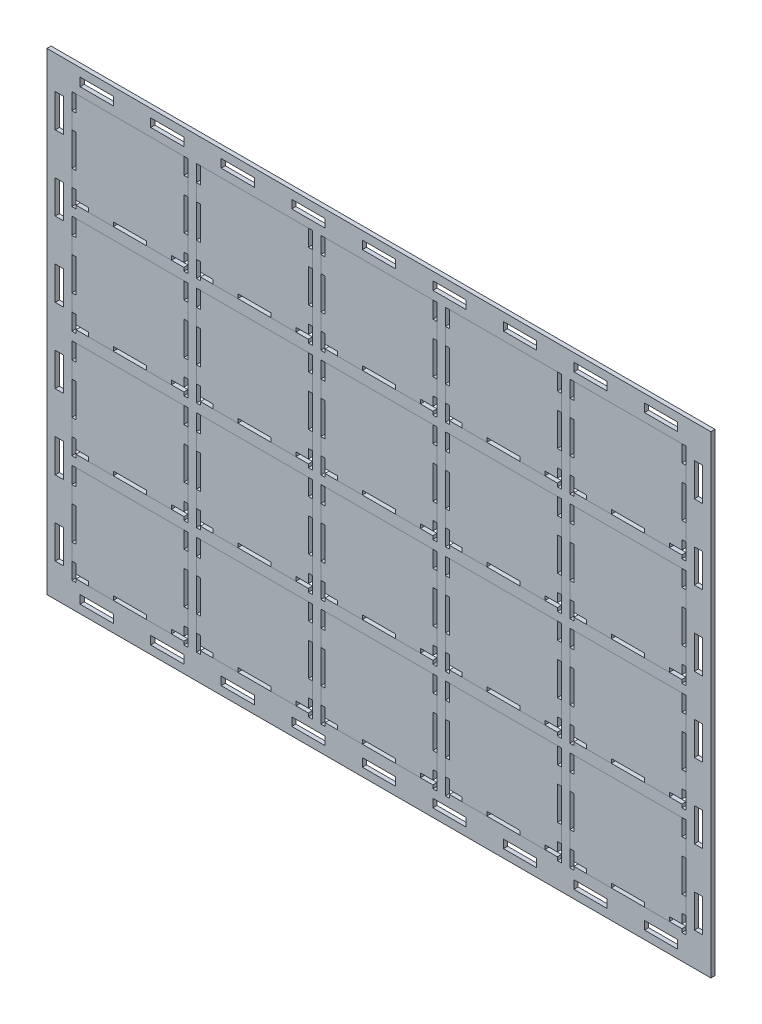
from build123d import *

# Parameters (mm, degrees)
SKETCH1_W              = 400
SKETCH1_H              = 285
SKETCH1_W_2            = 20
SKETCH1_H_2            = 5
SKETCH1_W_3            = 5
SKETCH1_H_3            = 20
BOSS_EXTRUDE1_DEPTH    = 2.5
BOSS_EXTRUDE2_DEPTH    = 2.5
BOSS_EXTRUDE2_2_DEPTH  = 2.5
BOSS_EXTRUDE2_3_DEPTH  = 2.5
BOSS_EXTRUDE2_4_DEPTH  = 2.5
BOSS_EXTRUDE2_5_DEPTH  = 2.5
BOSS_EXTRUDE2_6_DEPTH  = 2.5
BOSS_EXTRUDE2_7_DEPTH  = 2.5
BOSS_EXTRUDE2_8_DEPTH  = 2.5
BOSS_EXTRUDE2_9_DEPTH  = 2.5
BOSS_EXTRUDE2_10_DEPTH = 2.5
BOSS_EXTRUDE2_11_DEPTH = 2.5
BOSS_EXTRUDE2_12_DEPTH = 2.5
BOSS_EXTRUDE2_13_DEPTH = 2.5
BOSS_EXTRUDE2_14_DEPTH = 2.5
BOSS_EXTRUDE2_15_DEPTH = 2.5
BOSS_EXTRUDE2_16_DEPTH = 2.5
BOSS_EXTRUDE2_17_DEPTH = 2.5
BOSS_EXTRUDE2_18_DEPTH = 2.5
BOSS_EXTRUDE2_19_DEPTH = 2.5
BOSS_EXTRUDE2_20_DEPTH = 2.5


with BuildPart() as part:
    # Sketch1 → Boss-Extrude1 (new body)
    with BuildSketch(Plane.XY):
        with Locations((-141.295954422, 26.855853659)):
            Rectangle(SKETCH1_W, SKETCH1_H)
        with Locations((-311.295954422, -108.144146341)):
            Rectangle(SKETCH1_W_2, SKETCH1_H_2, mode=Mode.SUBTRACT)
        with Locations((-333.795954422, -85.644146341)):
            Rectangle(SKETCH1_W_3, SKETCH1_H_3, mode=Mode.SUBTRACT)
        with Locations((-268.795954422, -108.144146341)):
            Rectangle(SKETCH1_W_2, SKETCH1_H_2, mode=Mode.SUBTRACT)
        Polygon((-323.795954422, -98.644146341), (-323.795954422, -100.644146341), (-326.295954422, -100.644146341), (-326.295954422, -90.644146341), (-326.295954422, -80.644146341), (-326.295954422, -60.644146341), (-326.295954422, -50.644146341), (-326.295954422, -40.644146341), (-323.795954422, -40.644146341), (-258.795954422, -40.644146341), (-256.295954422, -40.644146341), (-256.295954422, -50.644146341), (-256.295954422, -60.644146341), (-256.295954422, -80.644146341), (-256.295954422, -90.644146341), (-256.295954422, -100.644146341), (-258.795954422, -100.644146341), (-258.795954422, -98.644146341), (-266.295954422, -98.644146341), (-281.295954422, -98.644146341), (-301.295954422, -98.644146341), (-316.295954422, -98.644146341), align=None, mode=Mode.SUBTRACT)
        with Locations((-226.295954422, -108.144146341)):
            Rectangle(SKETCH1_W_2, SKETCH1_H_2, mode=Mode.SUBTRACT)
        with Locations((-183.795954422, -108.144146341)):
            Rectangle(SKETCH1_W_2, SKETCH1_H_2, mode=Mode.SUBTRACT)
        Polygon((-248.795954422, -98.644146341), (-248.795954422, -100.644146341), (-251.295954422, -100.644146341), (-251.295954422, -90.644146341), (-251.295954422, -80.644146341), (-251.295954422, -60.644146341), (-251.295954422, -50.644146341), (-251.295954422, -40.644146341), (-248.795954422, -40.644146341), (-183.795954422, -40.644146341), (-181.295954422, -40.644146341), (-181.295954422, -50.644146341), (-181.295954422, -60.644146341), (-181.295954422, -80.644146341), (-181.295954422, -90.644146341), (-181.295954422, -100.644146341), (-183.795954422, -100.644146341), (-183.795954422, -98.644146341), (-191.295954422, -98.644146341), (-206.295954422, -98.644146341), (-226.295954422, -98.644146341), (-241.295954422, -98.644146341), align=None, mode=Mode.SUBTRACT)
        with Locations((-333.795954422, -40.644146341)):
            Rectangle(SKETCH1_W_3, SKETCH1_H_3, mode=Mode.SUBTRACT)
        with Locations((-333.795954422, 4.355853659)):
            Rectangle(SKETCH1_W_3, SKETCH1_H_3, mode=Mode.SUBTRACT)
        Polygon((-323.795954422, -33.644146341), (-323.795954422, -35.644146341), (-326.295954422, -35.644146341), (-326.295954422, -25.644146341), (-326.295954422, -15.644146341), (-326.295954422, 4.355853659), (-326.295954422, 14.355853659), (-326.295954422, 24.355853659), (-323.795954422, 24.355853659), (-258.795954422, 24.355853659), (-256.295954422, 24.355853659), (-256.295954422, 14.355853659), (-256.295954422, 4.355853659), (-256.295954422, -15.644146341), (-256.295954422, -25.644146341), (-256.295954422, -35.644146341), (-258.795954422, -35.644146341), (-258.795954422, -33.644146341), (-266.295954422, -33.644146341), (-281.295954422, -33.644146341), (-301.295954422, -33.644146341), (-316.295954422, -33.644146341), align=None, mode=Mode.SUBTRACT)
        Polygon((-248.795954422, -33.644146341), (-248.795954422, -35.644146341), (-251.295954422, -35.644146341), (-251.295954422, -25.644146341), (-251.295954422, -15.644146341), (-251.295954422, 4.355853659), (-251.295954422, 14.355853659), (-251.295954422, 24.355853659), (-248.795954422, 24.355853659), (-183.795954422, 24.355853659), (-181.295954422, 24.355853659), (-181.295954422, 14.355853659), (-181.295954422, 4.355853659), (-181.295954422, -15.644146341), (-181.295954422, -25.644146341), (-181.295954422, -35.644146341), (-183.795954422, -35.644146341), (-183.795954422, -33.644146341), (-191.295954422, -33.644146341), (-206.295954422, -33.644146341), (-226.295954422, -33.644146341), (-241.295954422, -33.644146341), align=None, mode=Mode.SUBTRACT)
        with Locations((-141.295954422, -108.144146341)):
            Rectangle(SKETCH1_W_2, SKETCH1_H_2, mode=Mode.SUBTRACT)
        with Locations((-98.795954422, -108.144146341)):
            Rectangle(SKETCH1_W_2, SKETCH1_H_2, mode=Mode.SUBTRACT)
        with Locations((-56.295954422, -108.144146341)):
            Rectangle(SKETCH1_W_2, SKETCH1_H_2, mode=Mode.SUBTRACT)
        Polygon((-173.795954422, -98.644146341), (-173.795954422, -100.644146341), (-176.295954422, -100.644146341), (-176.295954422, -90.644146341), (-176.295954422, -80.644146341), (-176.295954422, -60.644146341), (-176.295954422, -50.644146341), (-176.295954422, -40.644146341), (-173.795954422, -40.644146341), (-108.795954422, -40.644146341), (-106.295954422, -40.644146341), (-106.295954422, -50.644146341), (-106.295954422, -60.644146341), (-106.295954422, -80.644146341), (-106.295954422, -90.644146341), (-106.295954422, -100.644146341), (-108.795954422, -100.644146341), (-108.795954422, -98.644146341), (-116.295954422, -98.644146341), (-131.295954422, -98.644146341), (-151.295954422, -98.644146341), (-166.295954422, -98.644146341), align=None, mode=Mode.SUBTRACT)
        Polygon((-98.795954422, -98.644146341), (-98.795954422, -100.644146341), (-101.295954422, -100.644146341), (-101.295954422, -90.644146341), (-101.295954422, -80.644146341), (-101.295954422, -60.644146341), (-101.295954422, -50.644146341), (-101.295954422, -40.644146341), (-98.795954422, -40.644146341), (-33.795954422, -40.644146341), (-31.295954422, -40.644146341), (-31.295954422, -50.644146341), (-31.295954422, -60.644146341), (-31.295954422, -80.644146341), (-31.295954422, -90.644146341), (-31.295954422, -100.644146341), (-33.795954422, -100.644146341), (-33.795954422, -98.644146341), (-41.295954422, -98.644146341), (-56.295954422, -98.644146341), (-76.295954422, -98.644146341), (-91.295954422, -98.644146341), align=None, mode=Mode.SUBTRACT)
        with Locations((-13.795954422, -108.144146341)):
            Rectangle(SKETCH1_W_2, SKETCH1_H_2, mode=Mode.SUBTRACT)
        with Locations((28.704045578, -108.144146341)):
            Rectangle(SKETCH1_W_2, SKETCH1_H_2, mode=Mode.SUBTRACT)
        with Locations((51.204045578, -85.644146341)):
            Rectangle(SKETCH1_W_3, SKETCH1_H_3, mode=Mode.SUBTRACT)
        Polygon((-23.795954422, -98.644146341), (-23.795954422, -100.644146341), (-26.295954422, -100.644146341), (-26.295954422, -90.644146341), (-26.295954422, -80.644146341), (-26.295954422, -60.644146341), (-26.295954422, -50.644146341), (-26.295954422, -40.644146341), (-23.795954422, -40.644146341), (41.204045578, -40.644146341), (43.704045578, -40.644146341), (43.704045578, -50.644146341), (43.704045578, -60.644146341), (43.704045578, -80.644146341), (43.704045578, -90.644146341), (43.704045578, -100.644146341), (41.204045578, -100.644146341), (41.204045578, -98.644146341), (33.704045578, -98.644146341), (18.704045578, -98.644146341), (-1.295954422, -98.644146341), (-16.295954422, -98.644146341), align=None, mode=Mode.SUBTRACT)
        Polygon((-173.795954422, -33.644146341), (-173.795954422, -35.644146341), (-176.295954422, -35.644146341), (-176.295954422, -25.644146341), (-176.295954422, -15.644146341), (-176.295954422, 4.355853659), (-176.295954422, 14.355853659), (-176.295954422, 24.355853659), (-173.795954422, 24.355853659), (-108.795954422, 24.355853659), (-106.295954422, 24.355853659), (-106.295954422, 14.355853659), (-106.295954422, 4.355853659), (-106.295954422, -15.644146341), (-106.295954422, -25.644146341), (-106.295954422, -35.644146341), (-108.795954422, -35.644146341), (-108.795954422, -33.644146341), (-116.295954422, -33.644146341), (-131.295954422, -33.644146341), (-151.295954422, -33.644146341), (-166.295954422, -33.644146341), align=None, mode=Mode.SUBTRACT)
        Polygon((-98.795954422, -33.644146341), (-98.795954422, -35.644146341), (-101.295954422, -35.644146341), (-101.295954422, -25.644146341), (-101.295954422, -15.644146341), (-101.295954422, 4.355853659), (-101.295954422, 14.355853659), (-101.295954422, 24.355853659), (-98.795954422, 24.355853659), (-33.795954422, 24.355853659), (-31.295954422, 24.355853659), (-31.295954422, 14.355853659), (-31.295954422, 4.355853659), (-31.295954422, -15.644146341), (-31.295954422, -25.644146341), (-31.295954422, -35.644146341), (-33.795954422, -35.644146341), (-33.795954422, -33.644146341), (-41.295954422, -33.644146341), (-56.295954422, -33.644146341), (-76.295954422, -33.644146341), (-91.295954422, -33.644146341), align=None, mode=Mode.SUBTRACT)
        with Locations((51.204045578, -40.644146341)):
            Rectangle(SKETCH1_W_3, SKETCH1_H_3, mode=Mode.SUBTRACT)
        Polygon((-23.795954422, -33.644146341), (-23.795954422, -35.644146341), (-26.295954422, -35.644146341), (-26.295954422, -25.644146341), (-26.295954422, -15.644146341), (-26.295954422, 4.355853659), (-26.295954422, 14.355853659), (-26.295954422, 24.355853659), (-23.795954422, 24.355853659), (41.204045578, 24.355853659), (43.704045578, 24.355853659), (43.704045578, 14.355853659), (43.704045578, 4.355853659), (43.704045578, -15.644146341), (43.704045578, -25.644146341), (43.704045578, -35.644146341), (41.204045578, -35.644146341), (41.204045578, -33.644146341), (33.704045578, -33.644146341), (18.704045578, -33.644146341), (-1.295954422, -33.644146341), (-16.295954422, -33.644146341), align=None, mode=Mode.SUBTRACT)
        with Locations((51.204045578, 4.355853659)):
            Rectangle(SKETCH1_W_3, SKETCH1_H_3, mode=Mode.SUBTRACT)
        with Locations((-333.795954422, 49.355853659)):
            Rectangle(SKETCH1_W_3, SKETCH1_H_3, mode=Mode.SUBTRACT)
        Polygon((-323.795954422, 31.355853659), (-323.795954422, 29.355853659), (-326.295954422, 29.355853659), (-326.295954422, 39.355853659), (-326.295954422, 49.355853659), (-326.295954422, 69.355853659), (-326.295954422, 79.355853659), (-326.295954422, 89.355853659), (-323.795954422, 89.355853659), (-258.795954422, 89.355853659), (-256.295954422, 89.355853659), (-256.295954422, 79.355853659), (-256.295954422, 69.355853659), (-256.295954422, 49.355853659), (-256.295954422, 39.355853659), (-256.295954422, 29.355853659), (-258.795954422, 29.355853659), (-258.795954422, 31.355853659), (-266.295954422, 31.355853659), (-281.295954422, 31.355853659), (-301.295954422, 31.355853659), (-316.295954422, 31.355853659), align=None, mode=Mode.SUBTRACT)
        with Locations((-333.795954422, 94.355853659)):
            Rectangle(SKETCH1_W_3, SKETCH1_H_3, mode=Mode.SUBTRACT)
        Polygon((-248.795954422, 31.355853659), (-248.795954422, 29.355853659), (-251.295954422, 29.355853659), (-251.295954422, 39.355853659), (-251.295954422, 49.355853659), (-251.295954422, 69.355853659), (-251.295954422, 79.355853659), (-251.295954422, 89.355853659), (-248.795954422, 89.355853659), (-183.795954422, 89.355853659), (-181.295954422, 89.355853659), (-181.295954422, 79.355853659), (-181.295954422, 69.355853659), (-181.295954422, 49.355853659), (-181.295954422, 39.355853659), (-181.295954422, 29.355853659), (-183.795954422, 29.355853659), (-183.795954422, 31.355853659), (-191.295954422, 31.355853659), (-206.295954422, 31.355853659), (-226.295954422, 31.355853659), (-241.295954422, 31.355853659), align=None, mode=Mode.SUBTRACT)
        Polygon((-323.795954422, 96.355853659), (-323.795954422, 94.355853659), (-326.295954422, 94.355853659), (-326.295954422, 104.355853659), (-326.295954422, 114.355853659), (-326.295954422, 134.355853659), (-326.295954422, 144.355853659), (-326.295954422, 154.355853659), (-323.795954422, 154.355853659), (-258.795954422, 154.355853659), (-256.295954422, 154.355853659), (-256.295954422, 144.355853659), (-256.295954422, 134.355853659), (-256.295954422, 114.355853659), (-256.295954422, 104.355853659), (-256.295954422, 94.355853659), (-258.795954422, 94.355853659), (-258.795954422, 96.355853659), (-266.295954422, 96.355853659), (-281.295954422, 96.355853659), (-301.295954422, 96.355853659), (-316.295954422, 96.355853659), align=None, mode=Mode.SUBTRACT)
        with Locations((-333.795954422, 139.355853659)):
            Rectangle(SKETCH1_W_3, SKETCH1_H_3, mode=Mode.SUBTRACT)
        with Locations((-311.295954422, 161.855853659)):
            Rectangle(SKETCH1_W_2, SKETCH1_H_2, mode=Mode.SUBTRACT)
        with Locations((-268.795954422, 161.855853659)):
            Rectangle(SKETCH1_W_2, SKETCH1_H_2, mode=Mode.SUBTRACT)
        Polygon((-248.795954422, 96.355853659), (-248.795954422, 94.355853659), (-251.295954422, 94.355853659), (-251.295954422, 104.355853659), (-251.295954422, 114.355853659), (-251.295954422, 134.355853659), (-251.295954422, 144.355853659), (-251.295954422, 154.355853659), (-248.795954422, 154.355853659), (-183.795954422, 154.355853659), (-181.295954422, 154.355853659), (-181.295954422, 144.355853659), (-181.295954422, 134.355853659), (-181.295954422, 114.355853659), (-181.295954422, 104.355853659), (-181.295954422, 94.355853659), (-183.795954422, 94.355853659), (-183.795954422, 96.355853659), (-191.295954422, 96.355853659), (-206.295954422, 96.355853659), (-226.295954422, 96.355853659), (-241.295954422, 96.355853659), align=None, mode=Mode.SUBTRACT)
        with Locations((-226.295954422, 161.855853659)):
            Rectangle(SKETCH1_W_2, SKETCH1_H_2, mode=Mode.SUBTRACT)
        with Locations((-183.795954422, 161.855853659)):
            Rectangle(SKETCH1_W_2, SKETCH1_H_2, mode=Mode.SUBTRACT)
        Polygon((-173.795954422, 31.355853659), (-173.795954422, 29.355853659), (-176.295954422, 29.355853659), (-176.295954422, 39.355853659), (-176.295954422, 49.355853659), (-176.295954422, 69.355853659), (-176.295954422, 79.355853659), (-176.295954422, 89.355853659), (-173.795954422, 89.355853659), (-108.795954422, 89.355853659), (-106.295954422, 89.355853659), (-106.295954422, 79.355853659), (-106.295954422, 69.355853659), (-106.295954422, 49.355853659), (-106.295954422, 39.355853659), (-106.295954422, 29.355853659), (-108.795954422, 29.355853659), (-108.795954422, 31.355853659), (-116.295954422, 31.355853659), (-131.295954422, 31.355853659), (-151.295954422, 31.355853659), (-166.295954422, 31.355853659), align=None, mode=Mode.SUBTRACT)
        Polygon((-98.795954422, 31.355853659), (-98.795954422, 29.355853659), (-101.295954422, 29.355853659), (-101.295954422, 39.355853659), (-101.295954422, 49.355853659), (-101.295954422, 69.355853659), (-101.295954422, 79.355853659), (-101.295954422, 89.355853659), (-98.795954422, 89.355853659), (-33.795954422, 89.355853659), (-31.295954422, 89.355853659), (-31.295954422, 79.355853659), (-31.295954422, 69.355853659), (-31.295954422, 49.355853659), (-31.295954422, 39.355853659), (-31.295954422, 29.355853659), (-33.795954422, 29.355853659), (-33.795954422, 31.355853659), (-41.295954422, 31.355853659), (-56.295954422, 31.355853659), (-76.295954422, 31.355853659), (-91.295954422, 31.355853659), align=None, mode=Mode.SUBTRACT)
        Polygon((-23.795954422, 31.355853659), (-23.795954422, 29.355853659), (-26.295954422, 29.355853659), (-26.295954422, 39.355853659), (-26.295954422, 49.355853659), (-26.295954422, 69.355853659), (-26.295954422, 79.355853659), (-26.295954422, 89.355853659), (-23.795954422, 89.355853659), (41.204045578, 89.355853659), (43.704045578, 89.355853659), (43.704045578, 79.355853659), (43.704045578, 69.355853659), (43.704045578, 49.355853659), (43.704045578, 39.355853659), (43.704045578, 29.355853659), (41.204045578, 29.355853659), (41.204045578, 31.355853659), (33.704045578, 31.355853659), (18.704045578, 31.355853659), (-1.295954422, 31.355853659), (-16.295954422, 31.355853659), align=None, mode=Mode.SUBTRACT)
        with Locations((51.204045578, 49.355853659)):
            Rectangle(SKETCH1_W_3, SKETCH1_H_3, mode=Mode.SUBTRACT)
        with Locations((51.204045578, 94.355853659)):
            Rectangle(SKETCH1_W_3, SKETCH1_H_3, mode=Mode.SUBTRACT)
        Polygon((-173.795954422, 96.355853659), (-173.795954422, 94.355853659), (-176.295954422, 94.355853659), (-176.295954422, 104.355853659), (-176.295954422, 114.355853659), (-176.295954422, 134.355853659), (-176.295954422, 144.355853659), (-176.295954422, 154.355853659), (-173.795954422, 154.355853659), (-108.795954422, 154.355853659), (-106.295954422, 154.355853659), (-106.295954422, 144.355853659), (-106.295954422, 134.355853659), (-106.295954422, 114.355853659), (-106.295954422, 104.355853659), (-106.295954422, 94.355853659), (-108.795954422, 94.355853659), (-108.795954422, 96.355853659), (-116.295954422, 96.355853659), (-131.295954422, 96.355853659), (-151.295954422, 96.355853659), (-166.295954422, 96.355853659), align=None, mode=Mode.SUBTRACT)
        Polygon((-98.795954422, 96.355853659), (-98.795954422, 94.355853659), (-101.295954422, 94.355853659), (-101.295954422, 104.355853659), (-101.295954422, 114.355853659), (-101.295954422, 134.355853659), (-101.295954422, 144.355853659), (-101.295954422, 154.355853659), (-98.795954422, 154.355853659), (-33.795954422, 154.355853659), (-31.295954422, 154.355853659), (-31.295954422, 144.355853659), (-31.295954422, 134.355853659), (-31.295954422, 114.355853659), (-31.295954422, 104.355853659), (-31.295954422, 94.355853659), (-33.795954422, 94.355853659), (-33.795954422, 96.355853659), (-41.295954422, 96.355853659), (-56.295954422, 96.355853659), (-76.295954422, 96.355853659), (-91.295954422, 96.355853659), align=None, mode=Mode.SUBTRACT)
        with Locations((-141.295954422, 161.855853659)):
            Rectangle(SKETCH1_W_2, SKETCH1_H_2, mode=Mode.SUBTRACT)
        with Locations((-98.795954422, 161.855853659)):
            Rectangle(SKETCH1_W_2, SKETCH1_H_2, mode=Mode.SUBTRACT)
        with Locations((-56.295954422, 161.855853659)):
            Rectangle(SKETCH1_W_2, SKETCH1_H_2, mode=Mode.SUBTRACT)
        Polygon((-23.795954422, 94.355853659), (-26.295954422, 94.355853659), (-26.295954422, 104.355853659), (-26.295954422, 114.355853659), (-26.295954422, 134.355853659), (-26.295954422, 144.355853659), (-26.295954422, 154.355853659), (-23.795954422, 154.355853659), (41.204045578, 154.355853659), (43.704045578, 154.355853659), (43.704045578, 144.355853659), (43.704045578, 134.355853659), (43.704045578, 114.355853659), (43.704045578, 104.355853659), (43.704045578, 94.355853659), (41.204045578, 94.355853659), (41.204045578, 96.355853659), (33.704045578, 96.355853659), (18.704045578, 96.355853659), (-1.295954422, 96.355853659), (-16.295954422, 96.355853659), (-23.795954422, 96.355853659), align=None, mode=Mode.SUBTRACT)
        with Locations((-13.795954422, 161.855853659)):
            Rectangle(SKETCH1_W_2, SKETCH1_H_2, mode=Mode.SUBTRACT)
        with Locations((51.204045578, 139.355853659)):
            Rectangle(SKETCH1_W_3, SKETCH1_H_3, mode=Mode.SUBTRACT)
        with Locations((28.704045578, 161.855853659)):
            Rectangle(SKETCH1_W_2, SKETCH1_H_2, mode=Mode.SUBTRACT)
    extrude(amount=BOSS_EXTRUDE1_DEPTH)


with BuildPart() as body_2:
    # Sketch1<3> → Boss-Extrude2 (new body)
    with BuildSketch(Plane.XY):
        Polygon((-26.295954422, 114.355853659), (-26.295954422, 104.355853659), (-23.795954422, 104.355853659), (-23.795954422, 98.855853659), (-16.295954422, 98.855853659), (-16.295954422, 96.355853659), (-1.295954422, 96.355853659), (-1.295954422, 98.855853659), (18.704045578, 98.855853659), (18.704045578, 96.355853659), (33.704045578, 96.355853659), (33.704045578, 98.855853659), (41.204045578, 98.855853659), (41.204045578, 104.355853659), (43.704045578, 104.355853659), (43.704045578, 114.355853659), (41.204045578, 114.355853659), (41.204045578, 134.355853659), (43.704045578, 134.355853659), (43.704045578, 144.355853659), (41.204045578, 144.355853659), (41.204045578, 154.355853659), (-23.795954422, 154.355853659), (-23.795954422, 144.355853659), (-26.295954422, 144.355853659), (-26.295954422, 134.355853659), (-23.795954422, 134.355853659), (-23.795954422, 114.355853659), align=None)
    extrude(amount=BOSS_EXTRUDE2_DEPTH)


with BuildPart() as body_3:
    # Sketch1<3> → Boss-Extrude2 2 (new body)
    with BuildSketch(Plane.XY):
        Polygon((-26.295954422, 49.355853659), (-26.295954422, 39.355853659), (-23.795954422, 39.355853659), (-23.795954422, 33.855853659), (-16.295954422, 33.855853659), (-16.295954422, 31.355853659), (-1.295954422, 31.355853659), (-1.295954422, 33.855853659), (18.704045578, 33.855853659), (18.704045578, 31.355853659), (33.704045578, 31.355853659), (33.704045578, 33.855853659), (41.204045578, 33.855853659), (41.204045578, 39.355853659), (43.704045578, 39.355853659), (43.704045578, 49.355853659), (41.204045578, 49.355853659), (41.204045578, 69.355853659), (43.704045578, 69.355853659), (43.704045578, 79.355853659), (41.204045578, 79.355853659), (41.204045578, 89.355853659), (-23.795954422, 89.355853659), (-23.795954422, 79.355853659), (-26.295954422, 79.355853659), (-26.295954422, 69.355853659), (-23.795954422, 69.355853659), (-23.795954422, 49.355853659), align=None)
    extrude(amount=BOSS_EXTRUDE2_2_DEPTH)


with BuildPart() as body_4:
    # Sketch1<3> → Boss-Extrude2 3 (new body)
    with BuildSketch(Plane.XY):
        Polygon((-26.295954422, -15.644146341), (-26.295954422, -25.644146341), (-23.795954422, -25.644146341), (-23.795954422, -31.144146341), (-16.295954422, -31.144146341), (-16.295954422, -33.644146341), (-1.295954422, -33.644146341), (-1.295954422, -31.144146341), (18.704045578, -31.144146341), (18.704045578, -33.644146341), (33.704045578, -33.644146341), (33.704045578, -31.144146341), (41.204045578, -31.144146341), (41.204045578, -25.644146341), (43.704045578, -25.644146341), (43.704045578, -15.644146341), (41.204045578, -15.644146341), (41.204045578, 4.355853659), (43.704045578, 4.355853659), (43.704045578, 14.355853659), (41.204045578, 14.355853659), (41.204045578, 24.355853659), (-23.795954422, 24.355853659), (-23.795954422, 14.355853659), (-26.295954422, 14.355853659), (-26.295954422, 4.355853659), (-23.795954422, 4.355853659), (-23.795954422, -15.644146341), align=None)
    extrude(amount=BOSS_EXTRUDE2_3_DEPTH)


with BuildPart() as body_5:
    # Sketch1<3> → Boss-Extrude2 4 (new body)
    with BuildSketch(Plane.XY):
        Polygon((-26.295954422, -80.644146341), (-26.295954422, -90.644146341), (-23.795954422, -90.644146341), (-23.795954422, -96.144146341), (-16.295954422, -96.144146341), (-16.295954422, -98.644146341), (-1.295954422, -98.644146341), (-1.295954422, -96.144146341), (18.704045578, -96.144146341), (18.704045578, -98.644146341), (33.704045578, -98.644146341), (33.704045578, -96.144146341), (41.204045578, -96.144146341), (41.204045578, -90.644146341), (43.704045578, -90.644146341), (43.704045578, -80.644146341), (41.204045578, -80.644146341), (41.204045578, -60.644146341), (43.704045578, -60.644146341), (43.704045578, -50.644146341), (41.204045578, -50.644146341), (41.204045578, -40.644146341), (-23.795954422, -40.644146341), (-23.795954422, -50.644146341), (-26.295954422, -50.644146341), (-26.295954422, -60.644146341), (-23.795954422, -60.644146341), (-23.795954422, -80.644146341), align=None)
    extrude(amount=BOSS_EXTRUDE2_4_DEPTH)


with BuildPart() as body_6:
    # Sketch1<3> → Boss-Extrude2 5 (new body)
    with BuildSketch(Plane.XY):
        Polygon((-101.295954422, 114.355853659), (-101.295954422, 104.355853659), (-98.795954422, 104.355853659), (-98.795954422, 98.855853659), (-91.295954422, 98.855853659), (-91.295954422, 96.355853659), (-76.295954422, 96.355853659), (-76.295954422, 98.855853659), (-56.295954422, 98.855853659), (-56.295954422, 96.355853659), (-41.295954422, 96.355853659), (-41.295954422, 98.855853659), (-33.795954422, 98.855853659), (-33.795954422, 104.355853659), (-31.295954422, 104.355853659), (-31.295954422, 114.355853659), (-33.795954422, 114.355853659), (-33.795954422, 134.355853659), (-31.295954422, 134.355853659), (-31.295954422, 144.355853659), (-33.795954422, 144.355853659), (-33.795954422, 154.355853659), (-98.795954422, 154.355853659), (-98.795954422, 144.355853659), (-101.295954422, 144.355853659), (-101.295954422, 134.355853659), (-98.795954422, 134.355853659), (-98.795954422, 114.355853659), align=None)
    extrude(amount=BOSS_EXTRUDE2_5_DEPTH)


with BuildPart() as body_7:
    # Sketch1<3> → Boss-Extrude2 6 (new body)
    with BuildSketch(Plane.XY):
        Polygon((-101.295954422, 49.355853659), (-101.295954422, 39.355853659), (-98.795954422, 39.355853659), (-98.795954422, 33.855853659), (-91.295954422, 33.855853659), (-91.295954422, 31.355853659), (-76.295954422, 31.355853659), (-76.295954422, 33.855853659), (-56.295954422, 33.855853659), (-56.295954422, 31.355853659), (-41.295954422, 31.355853659), (-41.295954422, 33.855853659), (-33.795954422, 33.855853659), (-33.795954422, 39.355853659), (-31.295954422, 39.355853659), (-31.295954422, 49.355853659), (-33.795954422, 49.355853659), (-33.795954422, 69.355853659), (-31.295954422, 69.355853659), (-31.295954422, 79.355853659), (-33.795954422, 79.355853659), (-33.795954422, 89.355853659), (-98.795954422, 89.355853659), (-98.795954422, 79.355853659), (-101.295954422, 79.355853659), (-101.295954422, 69.355853659), (-98.795954422, 69.355853659), (-98.795954422, 49.355853659), align=None)
    extrude(amount=BOSS_EXTRUDE2_6_DEPTH)


with BuildPart() as body_8:
    # Sketch1<3> → Boss-Extrude2 7 (new body)
    with BuildSketch(Plane.XY):
        Polygon((-101.295954422, -15.644146341), (-101.295954422, -25.644146341), (-98.795954422, -25.644146341), (-98.795954422, -31.144146341), (-91.295954422, -31.144146341), (-91.295954422, -33.644146341), (-76.295954422, -33.644146341), (-76.295954422, -31.144146341), (-56.295954422, -31.144146341), (-56.295954422, -33.644146341), (-41.295954422, -33.644146341), (-41.295954422, -31.144146341), (-33.795954422, -31.144146341), (-33.795954422, -25.644146341), (-31.295954422, -25.644146341), (-31.295954422, -15.644146341), (-33.795954422, -15.644146341), (-33.795954422, 4.355853659), (-31.295954422, 4.355853659), (-31.295954422, 14.355853659), (-33.795954422, 14.355853659), (-33.795954422, 24.355853659), (-98.795954422, 24.355853659), (-98.795954422, 14.355853659), (-101.295954422, 14.355853659), (-101.295954422, 4.355853659), (-98.795954422, 4.355853659), (-98.795954422, -15.644146341), align=None)
    extrude(amount=BOSS_EXTRUDE2_7_DEPTH)


with BuildPart() as body_9:
    # Sketch1<3> → Boss-Extrude2 8 (new body)
    with BuildSketch(Plane.XY):
        Polygon((-101.295954422, -80.644146341), (-101.295954422, -90.644146341), (-98.795954422, -90.644146341), (-98.795954422, -96.144146341), (-91.295954422, -96.144146341), (-91.295954422, -98.644146341), (-76.295954422, -98.644146341), (-76.295954422, -96.144146341), (-56.295954422, -96.144146341), (-56.295954422, -98.644146341), (-41.295954422, -98.644146341), (-41.295954422, -96.144146341), (-33.795954422, -96.144146341), (-33.795954422, -90.644146341), (-31.295954422, -90.644146341), (-31.295954422, -80.644146341), (-33.795954422, -80.644146341), (-33.795954422, -60.644146341), (-31.295954422, -60.644146341), (-31.295954422, -50.644146341), (-33.795954422, -50.644146341), (-33.795954422, -40.644146341), (-98.795954422, -40.644146341), (-98.795954422, -50.644146341), (-101.295954422, -50.644146341), (-101.295954422, -60.644146341), (-98.795954422, -60.644146341), (-98.795954422, -80.644146341), align=None)
    extrude(amount=BOSS_EXTRUDE2_8_DEPTH)


with BuildPart() as body_10:
    # Sketch1<3> → Boss-Extrude2 9 (new body)
    with BuildSketch(Plane.XY):
        Polygon((-176.295954422, 114.355853659), (-176.295954422, 104.355853659), (-173.795954422, 104.355853659), (-173.795954422, 98.855853659), (-166.295954422, 98.855853659), (-166.295954422, 96.355853659), (-151.295954422, 96.355853659), (-151.295954422, 98.855853659), (-131.295954422, 98.855853659), (-131.295954422, 96.355853659), (-116.295954422, 96.355853659), (-116.295954422, 98.855853659), (-108.795954422, 98.855853659), (-108.795954422, 104.355853659), (-106.295954422, 104.355853659), (-106.295954422, 114.355853659), (-108.795954422, 114.355853659), (-108.795954422, 134.355853659), (-106.295954422, 134.355853659), (-106.295954422, 144.355853659), (-108.795954422, 144.355853659), (-108.795954422, 154.355853659), (-173.795954422, 154.355853659), (-173.795954422, 144.355853659), (-176.295954422, 144.355853659), (-176.295954422, 134.355853659), (-173.795954422, 134.355853659), (-173.795954422, 114.355853659), align=None)
    extrude(amount=BOSS_EXTRUDE2_9_DEPTH)


with BuildPart() as body_11:
    # Sketch1<3> → Boss-Extrude2 10 (new body)
    with BuildSketch(Plane.XY):
        Polygon((-176.295954422, 49.355853659), (-176.295954422, 39.355853659), (-173.795954422, 39.355853659), (-173.795954422, 33.855853659), (-166.295954422, 33.855853659), (-166.295954422, 31.355853659), (-151.295954422, 31.355853659), (-151.295954422, 33.855853659), (-131.295954422, 33.855853659), (-131.295954422, 31.355853659), (-116.295954422, 31.355853659), (-116.295954422, 33.855853659), (-108.795954422, 33.855853659), (-108.795954422, 39.355853659), (-106.295954422, 39.355853659), (-106.295954422, 49.355853659), (-108.795954422, 49.355853659), (-108.795954422, 69.355853659), (-106.295954422, 69.355853659), (-106.295954422, 79.355853659), (-108.795954422, 79.355853659), (-108.795954422, 89.355853659), (-173.795954422, 89.355853659), (-173.795954422, 79.355853659), (-176.295954422, 79.355853659), (-176.295954422, 69.355853659), (-173.795954422, 69.355853659), (-173.795954422, 49.355853659), align=None)
    extrude(amount=BOSS_EXTRUDE2_10_DEPTH)


with BuildPart() as body_12:
    # Sketch1<3> → Boss-Extrude2 11 (new body)
    with BuildSketch(Plane.XY):
        Polygon((-176.295954422, -15.644146341), (-176.295954422, -25.644146341), (-173.795954422, -25.644146341), (-173.795954422, -31.144146341), (-166.295954422, -31.144146341), (-166.295954422, -33.644146341), (-151.295954422, -33.644146341), (-151.295954422, -31.144146341), (-131.295954422, -31.144146341), (-131.295954422, -33.644146341), (-116.295954422, -33.644146341), (-116.295954422, -31.144146341), (-108.795954422, -31.144146341), (-108.795954422, -25.644146341), (-106.295954422, -25.644146341), (-106.295954422, -15.644146341), (-108.795954422, -15.644146341), (-108.795954422, 4.355853659), (-106.295954422, 4.355853659), (-106.295954422, 14.355853659), (-108.795954422, 14.355853659), (-108.795954422, 24.355853659), (-173.795954422, 24.355853659), (-173.795954422, 14.355853659), (-176.295954422, 14.355853659), (-176.295954422, 4.355853659), (-173.795954422, 4.355853659), (-173.795954422, -15.644146341), align=None)
    extrude(amount=BOSS_EXTRUDE2_11_DEPTH)


with BuildPart() as body_13:
    # Sketch1<3> → Boss-Extrude2 12 (new body)
    with BuildSketch(Plane.XY):
        Polygon((-176.295954422, -80.644146341), (-176.295954422, -90.644146341), (-173.795954422, -90.644146341), (-173.795954422, -96.144146341), (-166.295954422, -96.144146341), (-166.295954422, -98.644146341), (-151.295954422, -98.644146341), (-151.295954422, -96.144146341), (-131.295954422, -96.144146341), (-131.295954422, -98.644146341), (-116.295954422, -98.644146341), (-116.295954422, -96.144146341), (-108.795954422, -96.144146341), (-108.795954422, -90.644146341), (-106.295954422, -90.644146341), (-106.295954422, -80.644146341), (-108.795954422, -80.644146341), (-108.795954422, -60.644146341), (-106.295954422, -60.644146341), (-106.295954422, -50.644146341), (-108.795954422, -50.644146341), (-108.795954422, -40.644146341), (-173.795954422, -40.644146341), (-173.795954422, -50.644146341), (-176.295954422, -50.644146341), (-176.295954422, -60.644146341), (-173.795954422, -60.644146341), (-173.795954422, -80.644146341), align=None)
    extrude(amount=BOSS_EXTRUDE2_12_DEPTH)


with BuildPart() as body_14:
    # Sketch1<3> → Boss-Extrude2 13 (new body)
    with BuildSketch(Plane.XY):
        Polygon((-251.295954422, 114.355853659), (-251.295954422, 104.355853659), (-248.795954422, 104.355853659), (-248.795954422, 98.855853659), (-241.295954422, 98.855853659), (-241.295954422, 96.355853659), (-226.295954422, 96.355853659), (-226.295954422, 98.855853659), (-206.295954422, 98.855853659), (-206.295954422, 96.355853659), (-191.295954422, 96.355853659), (-191.295954422, 98.855853659), (-183.795954422, 98.855853659), (-183.795954422, 104.355853659), (-181.295954422, 104.355853659), (-181.295954422, 114.355853659), (-183.795954422, 114.355853659), (-183.795954422, 134.355853659), (-181.295954422, 134.355853659), (-181.295954422, 144.355853659), (-183.795954422, 144.355853659), (-183.795954422, 154.355853659), (-248.795954422, 154.355853659), (-248.795954422, 144.355853659), (-251.295954422, 144.355853659), (-251.295954422, 134.355853659), (-248.795954422, 134.355853659), (-248.795954422, 114.355853659), align=None)
    extrude(amount=BOSS_EXTRUDE2_13_DEPTH)


with BuildPart() as body_15:
    # Sketch1<3> → Boss-Extrude2 14 (new body)
    with BuildSketch(Plane.XY):
        Polygon((-251.295954422, 49.355853659), (-251.295954422, 39.355853659), (-248.795954422, 39.355853659), (-248.795954422, 33.855853659), (-241.295954422, 33.855853659), (-241.295954422, 31.355853659), (-226.295954422, 31.355853659), (-226.295954422, 33.855853659), (-206.295954422, 33.855853659), (-206.295954422, 31.355853659), (-191.295954422, 31.355853659), (-191.295954422, 33.855853659), (-183.795954422, 33.855853659), (-183.795954422, 39.355853659), (-181.295954422, 39.355853659), (-181.295954422, 49.355853659), (-183.795954422, 49.355853659), (-183.795954422, 69.355853659), (-181.295954422, 69.355853659), (-181.295954422, 79.355853659), (-183.795954422, 79.355853659), (-183.795954422, 89.355853659), (-248.795954422, 89.355853659), (-248.795954422, 79.355853659), (-251.295954422, 79.355853659), (-251.295954422, 69.355853659), (-248.795954422, 69.355853659), (-248.795954422, 49.355853659), align=None)
    extrude(amount=BOSS_EXTRUDE2_14_DEPTH)


with BuildPart() as body_16:
    # Sketch1<3> → Boss-Extrude2 15 (new body)
    with BuildSketch(Plane.XY):
        Polygon((-251.295954422, -15.644146341), (-251.295954422, -25.644146341), (-248.795954422, -25.644146341), (-248.795954422, -31.144146341), (-241.295954422, -31.144146341), (-241.295954422, -33.644146341), (-226.295954422, -33.644146341), (-226.295954422, -31.144146341), (-206.295954422, -31.144146341), (-206.295954422, -33.644146341), (-191.295954422, -33.644146341), (-191.295954422, -31.144146341), (-183.795954422, -31.144146341), (-183.795954422, -25.644146341), (-181.295954422, -25.644146341), (-181.295954422, -15.644146341), (-183.795954422, -15.644146341), (-183.795954422, 4.355853659), (-181.295954422, 4.355853659), (-181.295954422, 14.355853659), (-183.795954422, 14.355853659), (-183.795954422, 24.355853659), (-248.795954422, 24.355853659), (-248.795954422, 14.355853659), (-251.295954422, 14.355853659), (-251.295954422, 4.355853659), (-248.795954422, 4.355853659), (-248.795954422, -15.644146341), align=None)
    extrude(amount=BOSS_EXTRUDE2_15_DEPTH)


with BuildPart() as body_17:
    # Sketch1<3> → Boss-Extrude2 16 (new body)
    with BuildSketch(Plane.XY):
        Polygon((-251.295954422, -80.644146341), (-251.295954422, -90.644146341), (-248.795954422, -90.644146341), (-248.795954422, -96.144146341), (-241.295954422, -96.144146341), (-241.295954422, -98.644146341), (-226.295954422, -98.644146341), (-226.295954422, -96.144146341), (-206.295954422, -96.144146341), (-206.295954422, -98.644146341), (-191.295954422, -98.644146341), (-191.295954422, -96.144146341), (-183.795954422, -96.144146341), (-183.795954422, -90.644146341), (-181.295954422, -90.644146341), (-181.295954422, -80.644146341), (-183.795954422, -80.644146341), (-183.795954422, -60.644146341), (-181.295954422, -60.644146341), (-181.295954422, -50.644146341), (-183.795954422, -50.644146341), (-183.795954422, -40.644146341), (-248.795954422, -40.644146341), (-248.795954422, -50.644146341), (-251.295954422, -50.644146341), (-251.295954422, -60.644146341), (-248.795954422, -60.644146341), (-248.795954422, -80.644146341), align=None)
    extrude(amount=BOSS_EXTRUDE2_16_DEPTH)


with BuildPart() as body_18:
    # Sketch1<3> → Boss-Extrude2 17 (new body)
    with BuildSketch(Plane.XY):
        Polygon((-326.295954422, 114.355853659), (-326.295954422, 104.355853659), (-323.795954422, 104.355853659), (-323.795954422, 98.855853659), (-316.295954422, 98.855853659), (-316.295954422, 96.355853659), (-301.295954422, 96.355853659), (-301.295954422, 98.855853659), (-281.295954422, 98.855853659), (-281.295954422, 96.355853659), (-266.295954422, 96.355853659), (-266.295954422, 98.855853659), (-258.795954422, 98.855853659), (-258.795954422, 104.355853659), (-256.295954422, 104.355853659), (-256.295954422, 114.355853659), (-258.795954422, 114.355853659), (-258.795954422, 134.355853659), (-256.295954422, 134.355853659), (-256.295954422, 144.355853659), (-258.795954422, 144.355853659), (-258.795954422, 154.355853659), (-323.795954422, 154.355853659), (-323.795954422, 144.355853659), (-326.295954422, 144.355853659), (-326.295954422, 134.355853659), (-323.795954422, 134.355853659), (-323.795954422, 114.355853659), align=None)
    extrude(amount=BOSS_EXTRUDE2_17_DEPTH)


with BuildPart() as body_19:
    # Sketch1<3> → Boss-Extrude2 18 (new body)
    with BuildSketch(Plane.XY):
        Polygon((-326.295954422, 49.355853659), (-326.295954422, 39.355853659), (-323.795954422, 39.355853659), (-323.795954422, 33.855853659), (-316.295954422, 33.855853659), (-316.295954422, 31.355853659), (-301.295954422, 31.355853659), (-301.295954422, 33.855853659), (-281.295954422, 33.855853659), (-281.295954422, 31.355853659), (-266.295954422, 31.355853659), (-266.295954422, 33.855853659), (-258.795954422, 33.855853659), (-258.795954422, 39.355853659), (-256.295954422, 39.355853659), (-256.295954422, 49.355853659), (-258.795954422, 49.355853659), (-258.795954422, 69.355853659), (-256.295954422, 69.355853659), (-256.295954422, 79.355853659), (-258.795954422, 79.355853659), (-258.795954422, 89.355853659), (-323.795954422, 89.355853659), (-323.795954422, 79.355853659), (-326.295954422, 79.355853659), (-326.295954422, 69.355853659), (-323.795954422, 69.355853659), (-323.795954422, 49.355853659), align=None)
    extrude(amount=BOSS_EXTRUDE2_18_DEPTH)


with BuildPart() as body_20:
    # Sketch1<3> → Boss-Extrude2 19 (new body)
    with BuildSketch(Plane.XY):
        Polygon((-326.295954422, -15.644146341), (-326.295954422, -25.644146341), (-323.795954422, -25.644146341), (-323.795954422, -31.144146341), (-316.295954422, -31.144146341), (-316.295954422, -33.644146341), (-301.295954422, -33.644146341), (-301.295954422, -31.144146341), (-281.295954422, -31.144146341), (-281.295954422, -33.644146341), (-266.295954422, -33.644146341), (-266.295954422, -31.144146341), (-258.795954422, -31.144146341), (-258.795954422, -25.644146341), (-256.295954422, -25.644146341), (-256.295954422, -15.644146341), (-258.795954422, -15.644146341), (-258.795954422, 4.355853659), (-256.295954422, 4.355853659), (-256.295954422, 14.355853659), (-258.795954422, 14.355853659), (-258.795954422, 24.355853659), (-323.795954422, 24.355853659), (-323.795954422, 14.355853659), (-326.295954422, 14.355853659), (-326.295954422, 4.355853659), (-323.795954422, 4.355853659), (-323.795954422, -15.644146341), align=None)
    extrude(amount=BOSS_EXTRUDE2_19_DEPTH)


with BuildPart() as body_21:
    # Sketch1<3> → Boss-Extrude2 20 (new body)
    with BuildSketch(Plane.XY):
        Polygon((-326.295954422, -80.644146341), (-326.295954422, -90.644146341), (-323.795954422, -90.644146341), (-323.795954422, -96.144146341), (-316.295954422, -96.144146341), (-316.295954422, -98.644146341), (-301.295954422, -98.644146341), (-301.295954422, -96.144146341), (-281.295954422, -96.144146341), (-281.295954422, -98.644146341), (-266.295954422, -98.644146341), (-266.295954422, -96.144146341), (-258.795954422, -96.144146341), (-258.795954422, -90.644146341), (-256.295954422, -90.644146341), (-256.295954422, -80.644146341), (-258.795954422, -80.644146341), (-258.795954422, -60.644146341), (-256.295954422, -60.644146341), (-256.295954422, -50.644146341), (-258.795954422, -50.644146341), (-258.795954422, -40.644146341), (-323.795954422, -40.644146341), (-323.795954422, -50.644146341), (-326.295954422, -50.644146341), (-326.295954422, -60.644146341), (-323.795954422, -60.644146341), (-323.795954422, -80.644146341), align=None)
    extrude(amount=BOSS_EXTRUDE2_20_DEPTH)


solid = Compound([part.part, body_2.part, body_3.part, body_4.part, body_5.part, body_6.part, body_7.part, body_8.part, body_9.part, body_10.part, body_11.part, body_12.part, body_13.part, body_14.part, body_15.part, body_16.part, body_17.part, body_18.part, body_19.part, body_20.part, body_21.part])
